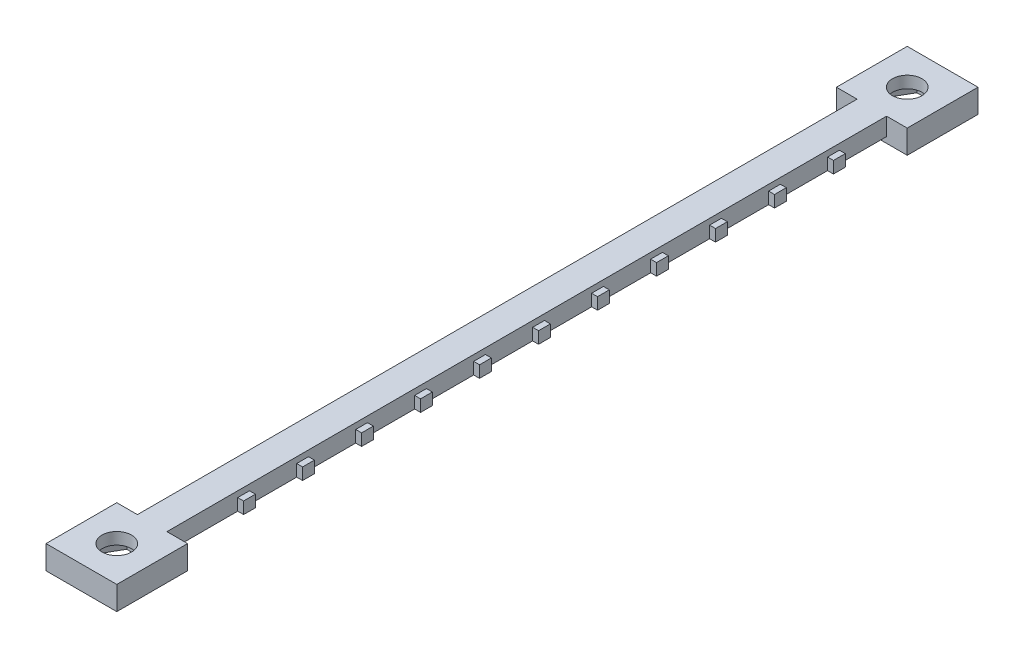
from build123d import *

# Parameters (mm, degrees)
BOSS_EXTRUDE1_DEPTH = 2
BOSS_EXTRUDE2_DEPTH = 1
SKETCH3_W           = 12
SKETCH3_H           = 12
BOSS_EXTRUDE3_DEPTH = 1
CUT_EXTRUDE1_DEPTH  = 2
SKETCH5_R           = 2.5
CUT_EXTRUDE2_DEPTH  = 5


with BuildPart() as part:
    # Sketch1 → Boss-Extrude1 (new body)
    with BuildSketch(Plane(origin=(0, 0, 0), x_dir=(1, 0, 0), z_dir=(0, 1, 0))):
        Polygon((7.22672382, 6.096), (7.22672382, 18.096), (6.22672382, 18.096), (6.22672382, 20.096), (7.22672382, 20.096), (7.22672382, 28.096), (6.22672382, 28.096), (6.22672382, 30.096), (7.22672382, 30.096), (7.22672382, 38.096), (6.22672382, 38.096), (6.22672382, 40.096), (7.22672382, 40.096), (7.22672382, 48.096), (6.22672382, 48.096), (6.22672382, 50.096), (7.22672382, 50.096), (7.22672382, 58.096), (6.22672382, 58.096), (6.22672382, 60.096), (7.22672382, 60.096), (7.22672382, 68.096), (6.22672382, 68.096), (6.22672382, 70.096), (7.22672382, 70.096), (7.22672382, 78.096), (6.22672382, 78.096), (6.22672382, 80.096), (7.22672382, 80.096), (7.22672382, 88.096), (6.22672382, 88.096), (6.22672382, 90.096), (7.22672382, 90.096), (7.22672382, 98.096), (6.22672382, 98.096), (6.22672382, 100.096), (7.22672382, 100.096), (7.22672382, 108.096), (6.22672382, 108.096), (6.22672382, 110.096), (7.22672382, 110.096), (7.22672382, 118.096), (6.22672382, 118.096), (6.22672382, 120.096), (7.22672382, 120.096), (7.22672382, 128.096), (3.72672382, 128.096), (3.72672382, 140.096), (15.72672382, 140.096), (15.72672382, 128.096), (12.22672382, 128.096), (12.22672382, 120.096), (13.22672382, 120.096), (13.22672382, 118.096), (12.22672382, 118.096), (12.22672382, 110.096), (13.226723821, 110.096), (13.226723821, 108.096), (12.22672382, 108.096), (12.22672382, 100.096), (13.226723821, 100.096), (13.226723821, 98.096), (12.22672382, 98.096), (12.22672382, 90.096), (13.226723821, 90.096), (13.226723821, 88.096), (12.22672382, 88.096), (12.22672382, 80.096), (13.226723821, 80.096), (13.226723821, 78.096), (12.22672382, 78.096), (12.22672382, 70.096), (13.226723821, 70.096), (13.226723821, 68.096), (12.22672382, 68.096), (12.22672382, 60.096), (13.226723821, 60.096), (13.226723821, 58.096), (12.22672382, 58.096), (12.22672382, 50.096), (13.226723821, 50.096), (13.226723821, 48.096), (12.22672382, 48.096), (12.22672382, 40.096), (13.226723821, 40.096), (13.226723821, 38.096), (12.22672382, 38.096), (12.22672382, 30.096), (13.226723821, 30.096), (13.226723821, 28.096), (12.22672382, 28.096), (12.22672382, 20.096), (13.226723821, 20.096), (13.226723821, 18.096), (12.22672382, 18.096), (12.22672382, 6.096), (15.72672382, 6.096), (15.72672382, -5.904), (3.72672382, -5.904), (3.72672382, 6.096), align=None)
    extrude(amount=BOSS_EXTRUDE1_DEPTH)

    # Sketch2 → Boss-Extrude2 (add)
    with BuildSketch(Plane(origin=(0, 2, 0), x_dir=(1, 0, 0), z_dir=(0, 1, 0))):
        Polygon((3.72672382, 140.096), (15.72672382, 140.096), (15.72672382, 128.096), (12.22672382, 128.096), (12.22672382, 6.096), (15.72672382, 6.096), (15.72672382, -5.904), (3.72672382, -5.904), (3.72672382, 6.096), (7.22672382, 6.096), (7.22672382, 128.096), (3.72672382, 128.096), align=None)
    extrude(amount=BOSS_EXTRUDE2_DEPTH)

    # Sketch3 → Boss-Extrude3 (add)
    with BuildSketch(Plane(origin=(0, 0, 0), x_dir=(-1, 0, 0), z_dir=(0, -1, 0))):
        with Locations((-9.72672382, 134.096)):
            Rectangle(SKETCH3_W, SKETCH3_H)
        with Locations((-9.72672382, 0.096)):
            Rectangle(SKETCH3_W, SKETCH3_H)
    extrude(amount=BOSS_EXTRUDE3_DEPTH)

    # Sketch4 → Cut-Extrude1 (cut)
    with BuildSketch(Plane(origin=(0, -1, 0), x_dir=(-1, 0, 0), z_dir=(0, -1, 0))):
        Polygon((-7.365059478, 138.096), (-11.983861632, 138.096), (-14.293262708, 134.096), (-11.983861632, 130.096), (-7.365059478, 130.096), (-5.055658401, 134.096), align=None)
        Polygon((-7.417322744, 4.096), (-12.036124897, 4.096), (-14.345525974, 0.096), (-12.036124897, -3.904), (-7.417322744, -3.904), (-5.107921667, 0.096), align=None)
    extrude(amount=-CUT_EXTRUDE1_DEPTH, mode=Mode.SUBTRACT)

    # Sketch5 → Cut-Extrude2 (cut)
    with BuildSketch(Plane(origin=(0, 1, 0), x_dir=(-1, 0, 0), z_dir=(0, -1, 0))):
        with Locations((-9.72672382, 0.096)):
            Circle(SKETCH5_R)
        with Locations((-9.72672382, 134.096)):
            Circle(SKETCH5_R)
    extrude(amount=-CUT_EXTRUDE2_DEPTH, mode=Mode.SUBTRACT)


solid = part.part
